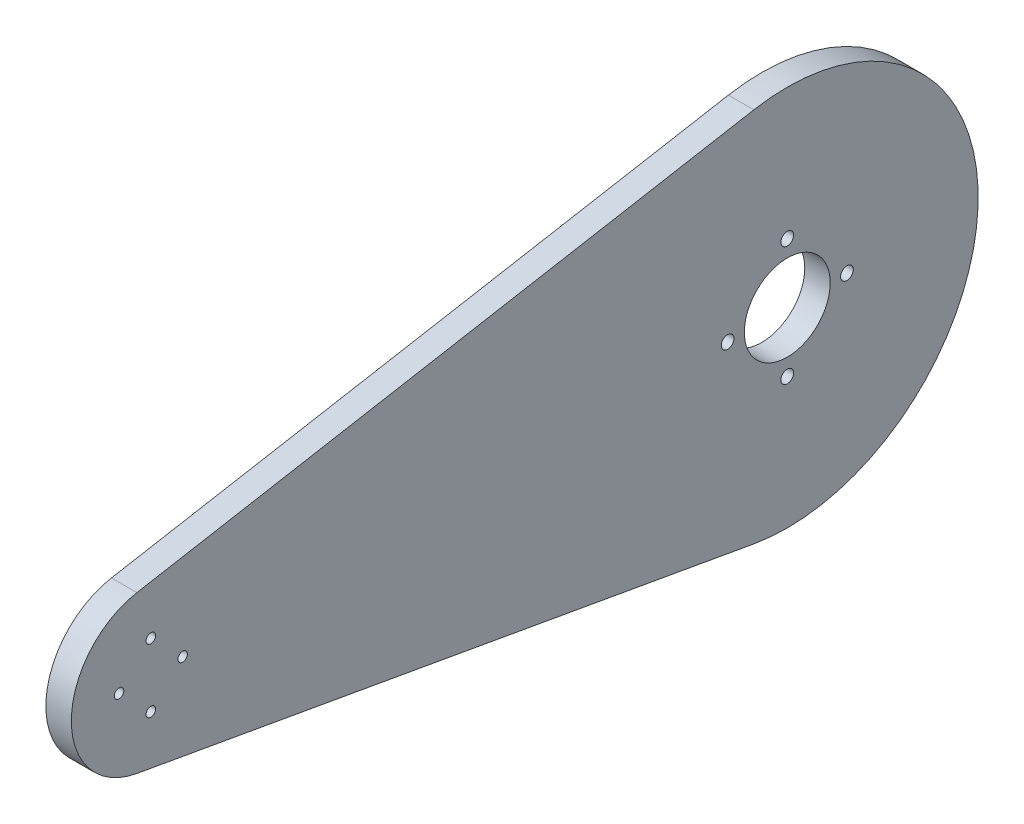
from build123d import *

# Parameters (mm, degrees)
SKETCH1_R           = 13.5
BOSS_EXTRUDE1_DEPTH = 4
SKETCH2_R           = 2
SKETCH2_R_2         = 1.5
CUT_EXTRUDE1_DEPTH  = 234


with BuildPart() as part:
    # Sketch1 → Boss-Extrude1 (new, symmetric)
    with BuildSketch(Plane(origin=(0, 0, 0), x_dir=(0, 0, -1), z_dir=(1, 0, 0))):
        with BuildLine():
            Line((-204.375, 24.614210834), (-10.5, 59.074106003))
            ThreePointArc((-10.5, 59.074106003), (60, 0), (-10.5, -59.074106003))
            Line((-10.5, -59.074106003), (-204.375, -24.614210834))
            ThreePointArc((-204.375, -24.614210834), (-225, 0), (-204.375, 24.614210834))
        make_face()
        Circle(SKETCH1_R, mode=Mode.SUBTRACT)
    extrude(amount=BOSS_EXTRUDE1_DEPTH, both=True)

    # Sketch2 → Cut-Extrude1 (cut, through all)
    with BuildSketch(Plane(origin=(4, 0, 0), x_dir=(0, 0, -1), z_dir=(1, 0, 0))):
        with Locations((0, 18.75)):
            Circle(SKETCH2_R)
        with Locations((18.75, 0)):
            Circle(SKETCH2_R)
        with Locations((0, -18.75)):
            Circle(SKETCH2_R)
        with Locations((-18.75, 0)):
            Circle(SKETCH2_R)
        with Locations((-210, 0)):
            Circle(SKETCH2_R_2)
        with Locations((-199.999998892, 10)):
            Circle(SKETCH2_R_2)
        with Locations((-189.999998892, -1.108e-06)):
            Circle(SKETCH2_R_2)
        with Locations((-200, -10.000001108)):
            Circle(SKETCH2_R_2)
    extrude(amount=-CUT_EXTRUDE1_DEPTH, mode=Mode.SUBTRACT)


solid = part.part
